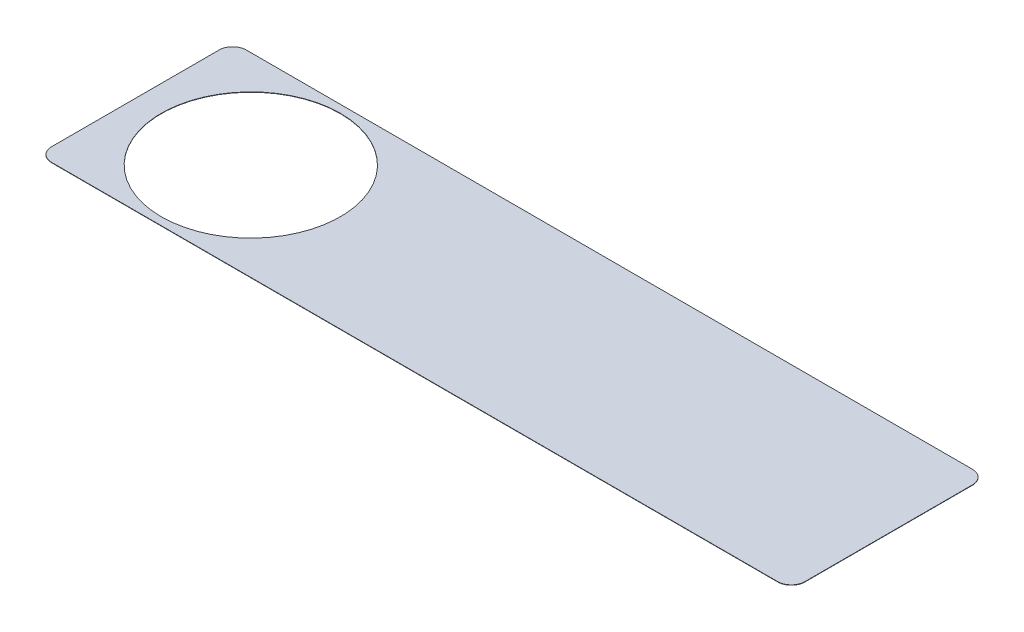
from build123d import *

# Parameters (mm, degrees)
SKETCH1_R           = 25.736334191
BOSS_EXTRUDE1_DEPTH = 0.1


with BuildPart() as part:
    # Sketch1 → Boss-Extrude1 (new body)
    with BuildSketch(Plane(origin=(0, 0, 0), x_dir=(1, 0, 0), z_dir=(0, 1, 0))):
        with BuildLine():
            Line((-76.705846626, 6.628303893), (-76.705846626, -41.491355388))
            ThreePointArc((-76.705846626, -41.491355388), (-75.563563073, -44.249071834), (-72.805846626, -45.391355388))
            Line((-72.805846626, -45.391355388), (135.779788281, -45.391355388))
            ThreePointArc((135.779788281, -45.391355388), (138.537504728, -44.249071834), (139.679788281, -41.491355388))
            Line((139.679788281, -41.491355388), (139.679788281, 6.628303893))
            ThreePointArc((139.679788281, 6.628303893), (138.537504728, 9.386020339), (135.779788281, 10.528303893))
            Line((135.779788281, 10.528303893), (-72.805846626, 10.528303893))
            ThreePointArc((-72.805846626, 10.528303893), (-75.563563073, 9.386020339), (-76.705846626, 6.628303893))
        make_face()
        with Locations((-43.538029172, -17.431525748)):
            Circle(SKETCH1_R, mode=Mode.SUBTRACT)
    extrude(amount=BOSS_EXTRUDE1_DEPTH)


solid = part.part
